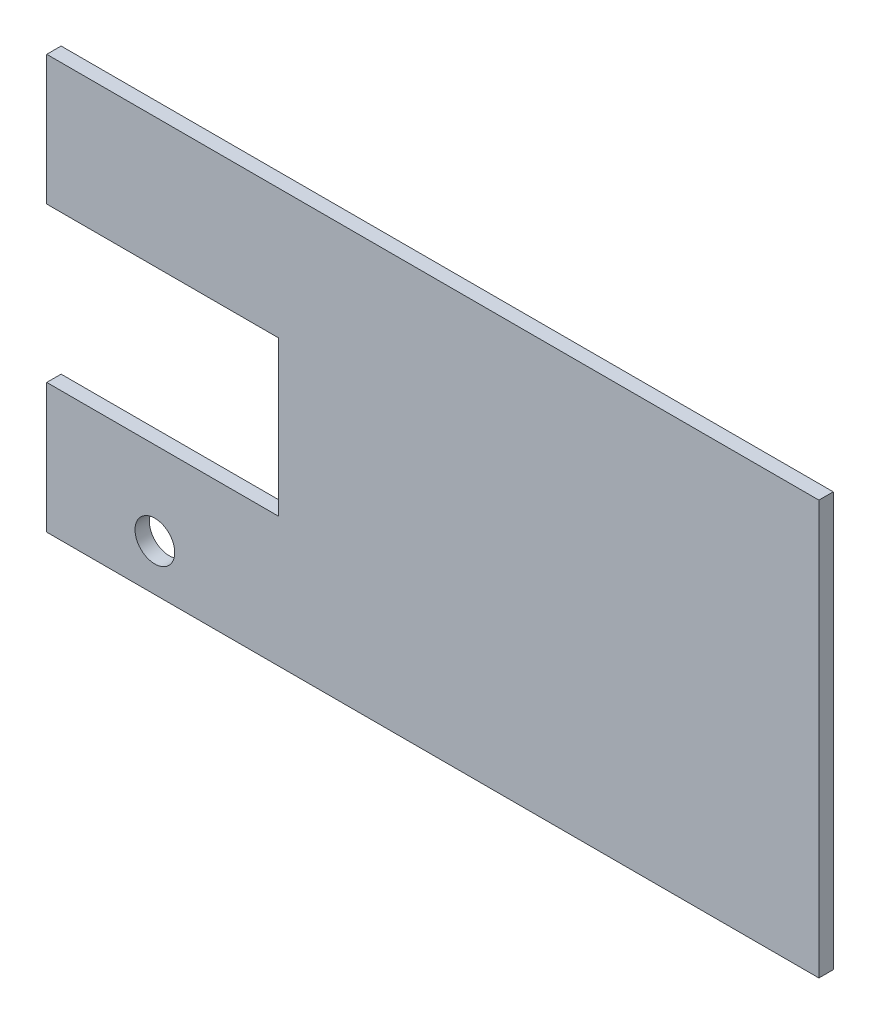
from build123d import *

# Parameters (mm, degrees)
SKETCH1_W           = 127
SKETCH1_H           = 68.072
BOSS_EXTRUDE1_DEPTH = 2.3622
SKETCH2_W           = 38.1
SKETCH2_H           = 25.4
CUT_EXTRUDE1_DEPTH  = 145.11237689
SKETCH3_R           = 3.2639
CUT_EXTRUDE2_DEPTH  = 145.11237689


with BuildPart() as part:
    # Sketch1 → Boss-Extrude1 (new body)
    with BuildSketch(Plane.XY):
        with Locations((63.5, 34.036)):
            Rectangle(SKETCH1_W, SKETCH1_H)
    extrude(amount=BOSS_EXTRUDE1_DEPTH)

    # Sketch2 → Cut-Extrude1 (cut, through all)
    with BuildSketch(Plane.XY.offset(2.3622)):
        with Locations((19.05, 34.036)):
            Rectangle(SKETCH2_W, SKETCH2_H)
    extrude(amount=-CUT_EXTRUDE1_DEPTH, mode=Mode.SUBTRACT)

    # Sketch3 → Cut-Extrude2 (cut, through all)
    with BuildSketch(Plane.XY.offset(2.3622)):
        with Locations((17.78, 7.62)):
            Circle(SKETCH3_R)
    extrude(amount=-CUT_EXTRUDE2_DEPTH, mode=Mode.SUBTRACT)


solid = part.part
